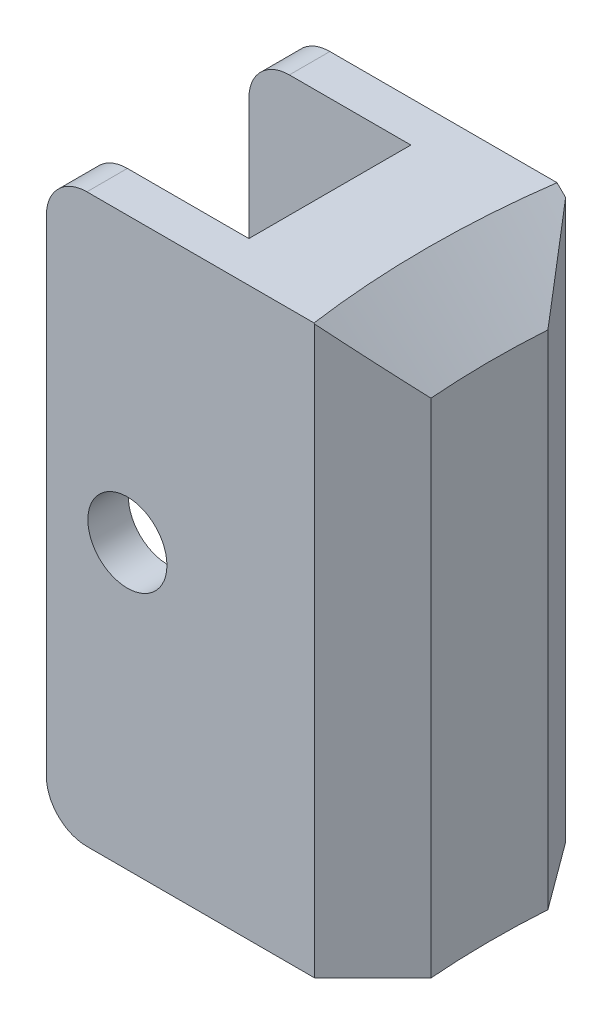
from build123d import *

# Parameters (mm, degrees)
SKETCH1_W           = 15.875
SKETCH1_H           = 22.225
BOSS_EXTRUDE1_DEPTH = 4.7625
SKETCH2_W           = 6.35
SKETCH2_H           = 22.225
CUT_EXTRUDE1_DEPTH  = 3.175
SKETCH3_R           = 31.75
CUT_EXTRUDE2_DEPTH  = 50.924287989
CHAMFER1_SIZE       = 2.23064129
CHAMFER1_SIZE_2     = 2.54
SKETCH4_R           = 1.55
CUT_EXTRUDE3_DEPTH  = 47.797604439
FILLET1_R           = 1.5875


with BuildPart() as part:
    # Sketch1 → Boss-Extrude1 (new, symmetric)
    with BuildSketch(Plane.XY):
        with Locations((-36.5125, 0)):
            Rectangle(SKETCH1_W, SKETCH1_H)
    extrude(amount=BOSS_EXTRUDE1_DEPTH, both=True)

    # Sketch2 → Cut-Extrude1 (cut, symmetric)
    with BuildSketch(Plane.XY):
        with Locations((-41.275, 0)):
            Rectangle(SKETCH2_W, SKETCH2_H)
    extrude(amount=CUT_EXTRUDE1_DEPTH, both=True, mode=Mode.SUBTRACT)

    # Sketch3 → Cut-Extrude2 (cut, through all)
    with BuildSketch(Plane(origin=(0, 11.1125, 0), x_dir=(1, 0, 0), z_dir=(0, 1, 0))):
        Circle(SKETCH3_R)
    extrude(amount=-CUT_EXTRUDE2_DEPTH, mode=Mode.SUBTRACT)

    # Chamfer1
    # the kernel refuses this chamfer: 2.54, 2.23064129 mm, written as the material it takes off along each edge
    with BuildSketch(Plane(origin=(-31.390780394, -17.93455078, -4.7625), x_dir=(-1, 0, 0), z_dir=(0, 1, 0))) as chamfer1_piece_1:
        with BuildLine():
            Line((CHAMFER1_SIZE, 0), (0.288027051, 2.637492029))
            ThreePointArc((0.288027051, 2.637492029), (0.17562072, 1.352980867), (0, 0))
            Line((0, 0), (CHAMFER1_SIZE, 0))
        make_face()
    extrude(amount=35.86910156, mode=Mode.SUBTRACT)
    with BuildSketch(Plane(origin=(-31.390780394, -17.644574789, 4.7625), x_dir=(-1, 0, 0), z_dir=(0, 1, 0))) as chamfer1_piece_2:
        with BuildLine():
            Line((CHAMFER1_SIZE_2, 0), (0.261871886, -2.278128114))
            ThreePointArc((0.261871886, -2.278128114), (0.155107804, -1.168138054), (0, 0))
            Line((0, 0), (CHAMFER1_SIZE_2, 0))
        make_face()
    extrude(amount=35.289149579, mode=Mode.SUBTRACT)
    with BuildSketch(Plane(origin=(0, 11.1125, 0), x_dir=(-0.9371917542835735, 0, -0.34881458642504903), z_dir=(0.34881458642504903, 0, -0.9371917542835735))) as chamfer1_piece_3:
        Polygon((31.75 + CHAMFER1_SIZE_2, 0), (31.75, -CHAMFER1_SIZE_2), (31.75, 0), align=None)
    revolve(axis=Axis((0, 11.1125, 0), (0, 1, 0)), revolution_arc=40.829654119, mode=Mode.SUBTRACT)

    # Sketch4 → Cut-Extrude3 (cut, through all)
    with BuildSketch(Plane.XY.offset(4.7625)):
        with Locations((-41.275, 0)):
            Circle(SKETCH4_R)
    extrude(amount=-CUT_EXTRUDE3_DEPTH, mode=Mode.SUBTRACT)

    # Fillet1
    fillet1_edges = [part.edges().sort_by_distance(p)[0] for p in [
        (-44.45, -11.1125, -3.96875),
        (-44.45, 11.1125, -3.96875),
        (-44.45, -11.1125, 3.96875),
        (-44.45, 11.1125, 3.96875),
    ]]
    fillet(fillet1_edges, radius=FILLET1_R)


solid = part.part
